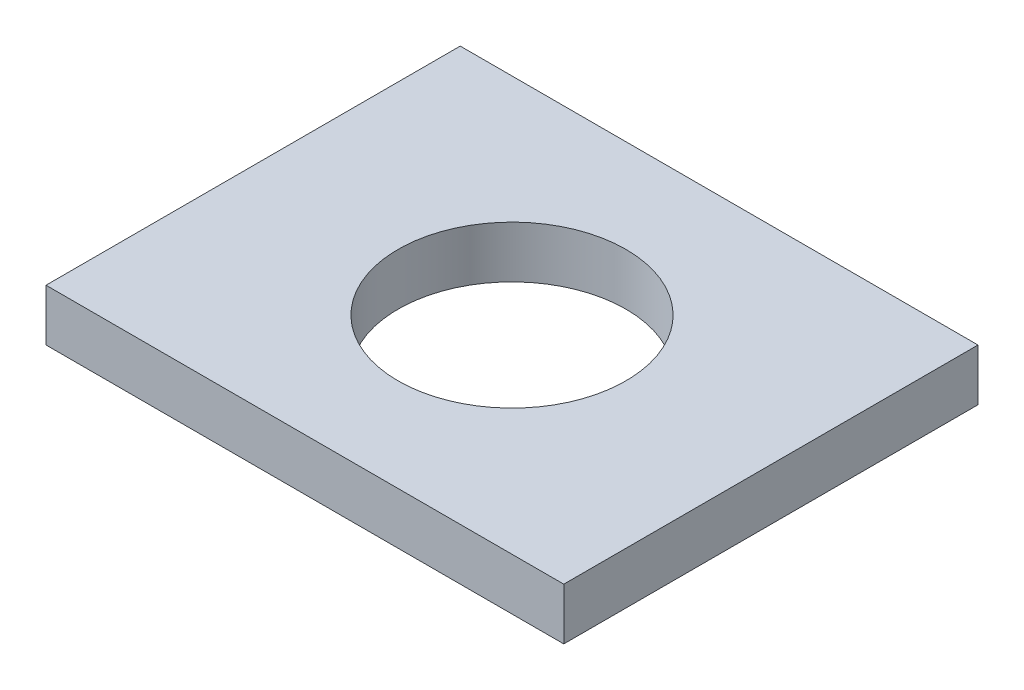
from build123d import *

# Parameters (mm, degrees)
SKETCH1_W           = 50
SKETCH1_H           = 40
BOSS_EXTRUDE1_DEPTH = 5
SKETCH2_R           = 11
CUT_EXTRUDE1_DEPTH  = 33.403703492


with BuildPart() as part:
    # Sketch1 → Boss-Extrude1 (new body)
    with BuildSketch(Plane(origin=(0, 0, 0), x_dir=(1, 0, 0), z_dir=(0, 1, 0))):
        Rectangle(SKETCH1_W, SKETCH1_H)
    extrude(amount=BOSS_EXTRUDE1_DEPTH)

    # Sketch2 → Cut-Extrude1 (cut, through all)
    with BuildSketch(Plane(origin=(0, 5, 0), x_dir=(1, 0, 0), z_dir=(0, 1, 0))):
        Circle(SKETCH2_R)
    extrude(amount=-CUT_EXTRUDE1_DEPTH, mode=Mode.SUBTRACT)


solid = part.part
